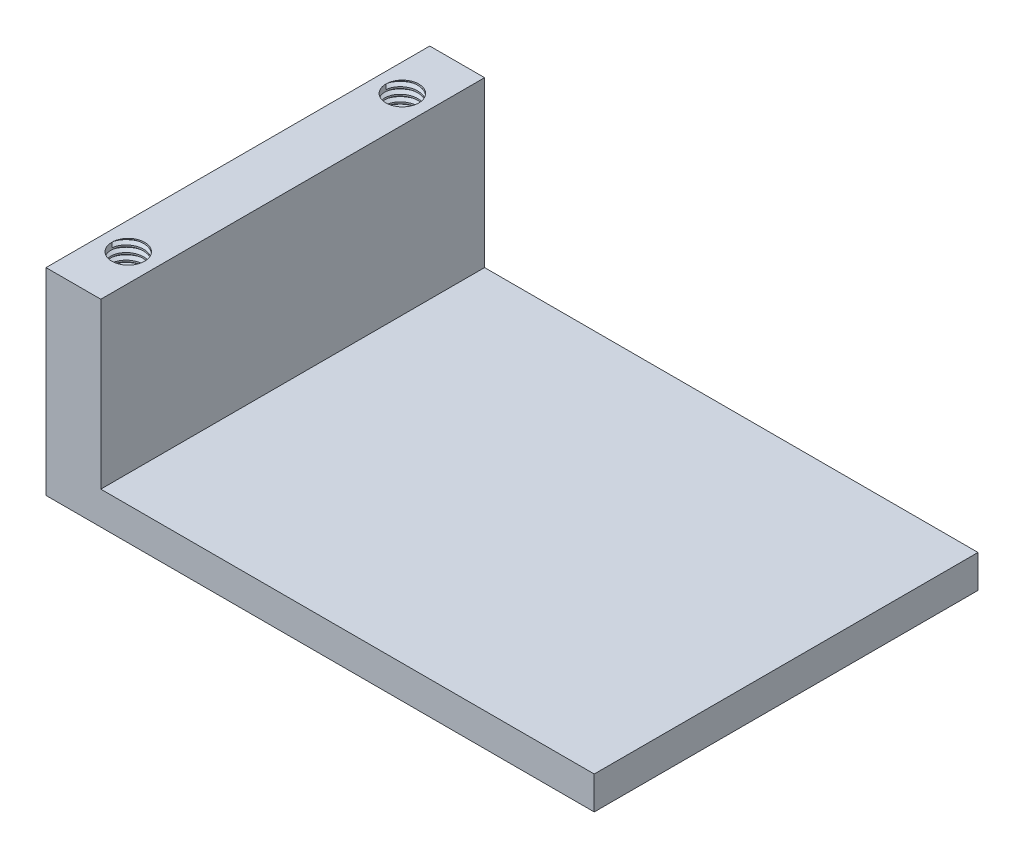
from build123d import *
from build123d.topology import SkipClean

# Parameters (mm, degrees)
BOSS_EXTRUDE1_DEPTH = 35
SKETCH2_R           = 1.5
CUT_EXTRUDE1_DEPTH  = 9
THREAD1_PITCH       = 0.6
THREAD2_PITCH       = 0.6


with BuildPart() as part:
    # Sketch1 → Boss-Extrude1 (new body)
    with BuildSketch(Plane.XY):
        Polygon((0, 0), (4, 0), (50, 0), (50, 3), (5, 3), (5, 18), (0, 18), align=None)
    extrude(amount=BOSS_EXTRUDE1_DEPTH)

    # Sketch2 → Cut-Extrude1 (cut)
    with BuildSketch(Plane(origin=(0, 18, 0), x_dir=(1, 0, 0), z_dir=(0, 1, 0))):
        with Locations(Location((2.5, -5, 0), (0, 0, 270))):
            Circle(SKETCH2_R)
        with Locations(Location((2.5, -30, 0), (0, 0, 270))):
            Circle(SKETCH2_R)
    extrude(amount=-CUT_EXTRUDE1_DEPTH, mode=Mode.SUBTRACT)

    # Thread1: the profile of Thread Profile1 profile screwed along a right-hand helix of 16.666667 turns, 6 arcs to a turn; built about Z, then put on its axis
    with SkipClean():  # the faces are left unmerged after this step: merging them gives an invalid solid
        thread1_z = Axis((0, 0, 0), (0, 0, 1))
        thread1_corners = [(1.4997, 0, -0.000173205), (1.824759525, 0, 0.187499999), (1.824759525, 0, 0.262499999), (1.4997, 0, 0.450173203)]
        with BuildLine(mode=Mode.PRIVATE) as thread1_profile:
            Line(thread1_corners[0], thread1_corners[1])
            Line(thread1_corners[1], thread1_corners[2])
            Line(thread1_corners[2], thread1_corners[3])
            Line(thread1_corners[3], thread1_corners[0])
        thread1_cap = Face(thread1_profile.wire())
        thread1_turn_angles = [0, 30, 60, 90, 120, 150, 180, 210, 240, 270, 300, 330, 360]
        thread1_turn_weights = [1, 0.8660254037844387, 1, 0.8660254037844387, 1, 0.8660254037844387, 1, 0.8660254037844387, 1, 0.8660254037844387, 1, 0.8660254037844387, 1]
        thread1_turn_rails = [Edge.make_bspline([Vector(p[0], p[1], 0).rotate(thread1_z, thread1_turn_angles[k]) / thread1_turn_weights[k] + Vector(0, 0, p[2] + THREAD1_PITCH * thread1_turn_angles[k] / 360) for k in range(13)], [0, 0, 0, 1, 1, 2, 2, 3, 3, 4, 4, 5, 5, 6, 6, 6], 2, thread1_turn_weights) for p in thread1_corners]
        thread1_turn_sides = [Face.make_surface_from_curves(thread1_turn_rails[p[0]], thread1_turn_rails[p[1]]) for p in [(0, 1), (1, 2), (2, 3), (3, 0)]]
        thread1_last_angles = [5760, 5790, 5820, 5850, 5880, 5910, 5940, 5970, 6000]
        thread1_last_weights = [1, 0.8660254037844387, 1, 0.8660254037844387, 1, 0.8660254037844387, 1, 0.8660254037844387, 1]
        thread1_last_rails = [Edge.make_bspline([Vector(p[0], p[1], 0).rotate(thread1_z, thread1_last_angles[k]) / thread1_last_weights[k] + Vector(0, 0, p[2] + THREAD1_PITCH * thread1_last_angles[k] / 360) for k in range(9)], [0, 0, 0, 1, 1, 2, 2, 3, 3, 4, 4, 4], 2, thread1_last_weights) for p in thread1_corners]
        thread1_last_sides = [Face.make_surface_from_curves(thread1_last_rails[p[0]], thread1_last_rails[p[1]]) for p in [(0, 1), (1, 2), (2, 3), (3, 0)]]
        thread1 = Plane(origin=(2.5, 18, 30), x_dir=(-1, 0, 0), z_dir=(0, -1, 0)) * Solid(Shell([*[p.moved(Location((0, 0, THREAD1_PITCH * i))) for i in range(16) for p in thread1_turn_sides], *thread1_last_sides, thread1_cap, thread1_cap.rotate(thread1_z, 6000).moved(Location((0, 0, THREAD1_PITCH * 6000 / 360)))]))
        add(thread1, mode=Mode.SUBTRACT)

    # Thread2: the profile of Thread Profile2 profile screwed along a right-hand helix of 16.666667 turns, 6 arcs to a turn; built about Z, then put on its axis
    with SkipClean():  # the faces are left unmerged after this step: merging them gives an invalid solid
        thread2_z = Axis((0, 0, 0), (0, 0, 1))
        thread2_corners = [(1.4997, 0, -0.000173205), (1.824759525, 0, 0.187499999), (1.824759525, 0, 0.262499999), (1.4997, 0, 0.450173203)]
        with BuildLine(mode=Mode.PRIVATE) as thread2_profile:
            Line(thread2_corners[0], thread2_corners[1])
            Line(thread2_corners[1], thread2_corners[2])
            Line(thread2_corners[2], thread2_corners[3])
            Line(thread2_corners[3], thread2_corners[0])
        thread2_cap = Face(thread2_profile.wire())
        thread2_turn_angles = [0, 30, 60, 90, 120, 150, 180, 210, 240, 270, 300, 330, 360]
        thread2_turn_weights = [1, 0.8660254037844387, 1, 0.8660254037844387, 1, 0.8660254037844387, 1, 0.8660254037844387, 1, 0.8660254037844387, 1, 0.8660254037844387, 1]
        thread2_turn_rails = [Edge.make_bspline([Vector(p[0], p[1], 0).rotate(thread2_z, thread2_turn_angles[k]) / thread2_turn_weights[k] + Vector(0, 0, p[2] + THREAD2_PITCH * thread2_turn_angles[k] / 360) for k in range(13)], [0, 0, 0, 1, 1, 2, 2, 3, 3, 4, 4, 5, 5, 6, 6, 6], 2, thread2_turn_weights) for p in thread2_corners]
        thread2_turn_sides = [Face.make_surface_from_curves(thread2_turn_rails[p[0]], thread2_turn_rails[p[1]]) for p in [(0, 1), (1, 2), (2, 3), (3, 0)]]
        thread2_last_angles = [5760, 5790, 5820, 5850, 5880, 5910, 5940, 5970, 6000]
        thread2_last_weights = [1, 0.8660254037844387, 1, 0.8660254037844387, 1, 0.8660254037844387, 1, 0.8660254037844387, 1]
        thread2_last_rails = [Edge.make_bspline([Vector(p[0], p[1], 0).rotate(thread2_z, thread2_last_angles[k]) / thread2_last_weights[k] + Vector(0, 0, p[2] + THREAD2_PITCH * thread2_last_angles[k] / 360) for k in range(9)], [0, 0, 0, 1, 1, 2, 2, 3, 3, 4, 4, 4], 2, thread2_last_weights) for p in thread2_corners]
        thread2_last_sides = [Face.make_surface_from_curves(thread2_last_rails[p[0]], thread2_last_rails[p[1]]) for p in [(0, 1), (1, 2), (2, 3), (3, 0)]]
        thread2 = Plane(origin=(2.5, 18, 5), x_dir=(-1, 0, 0), z_dir=(0, -1, 0)) * Solid(Shell([*[p.moved(Location((0, 0, THREAD2_PITCH * i))) for i in range(16) for p in thread2_turn_sides], *thread2_last_sides, thread2_cap, thread2_cap.rotate(thread2_z, 6000).moved(Location((0, 0, THREAD2_PITCH * 6000 / 360)))]))
        add(thread2, mode=Mode.SUBTRACT)


solid = part.part
